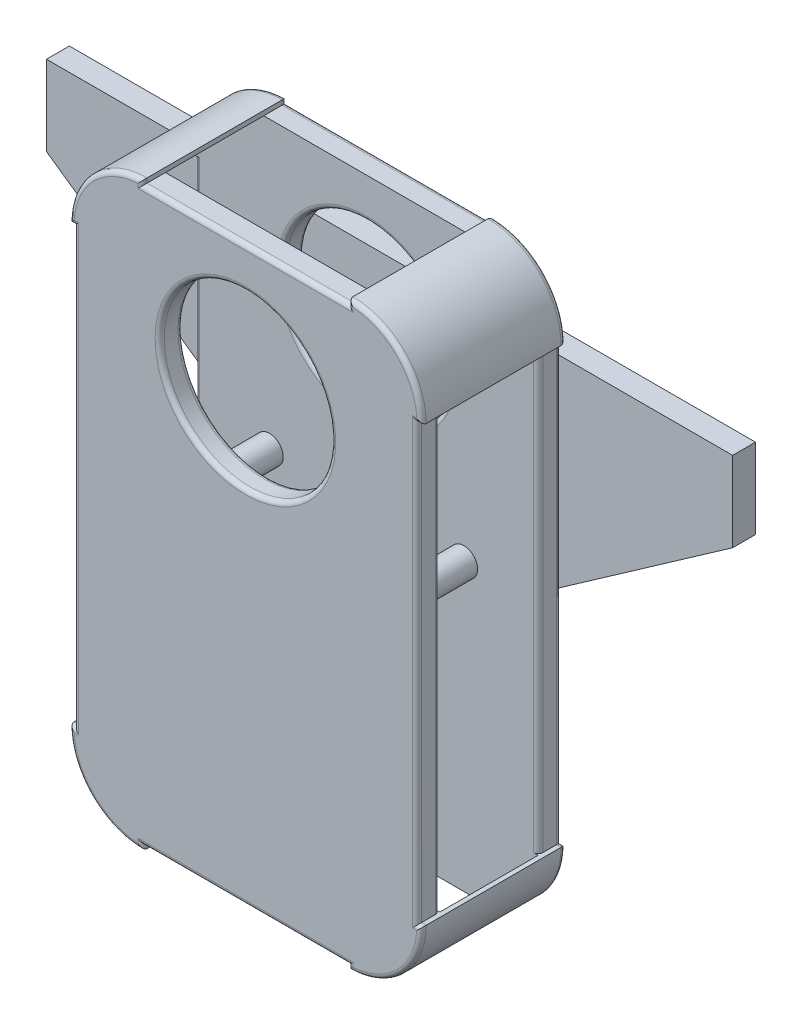
from build123d import *

# Parameters (mm, degrees)
BOSS_EXTRUDE1_DEPTH       = 10
BOSS_EXTRUDE2_DEPTH       = 10
SKETCH5_R                 = 37.5
CUT_EXTRUDE1_DEPTH        = 170
FILLET1_R                 = 2
FILLET2_R                 = 2
BOSS_EXTRUDE3_REACH       = 160.805
FILLET3_R                 = 2
FILLET4_R                 = 2
FILLET8_R                 = 2
SKETCH8_R                 = 6
CUT_EXTRUDE4_DEPTH        = 101
SKETCH19_R                = 6
BOSS_EXTRUDE11_DEPTH      = 63
BOSS_EXTRUDE11_2_DEPTH    = 63
BOSS_EXTRUDE12_DEPTH      = 43
BOSS_EXTRUDE12_DEPTH_BACK = 10
SKETCH20_R                = 6
BOSS_EXTRUDE13_START      = 63
BOSS_EXTRUDE13_DEPTH      = 10


# Some blends are built 0.0001 mm under size
with BuildPart() as part:
    # Sketch2 → Boss-Extrude1 (new body)
    with BuildSketch(Plane.XY):
        with BuildLine():
            Line((-45, -125), (45, -125))
            ThreePointArc((45, -125), (66.213203436, -116.213203436), (75, -95))
            Line((75, -95), (75, 95))
            ThreePointArc((75, 95), (66.213203436, 116.213203436), (45, 125))
            Line((45, 125), (-45, 125))
            ThreePointArc((-45, 125), (-66.213203436, 116.213203436), (-75, 95))
            Line((-75, 95), (-75, -95))
            ThreePointArc((-75, -95), (-66.213203436, -116.213203436), (-45, -125))
        make_face()
    extrude(amount=BOSS_EXTRUDE1_DEPTH)


with BuildPart() as body_2:
    # Sketch4 → Boss-Extrude2 (new body)
    with BuildSketch(Plane(origin=(0, 0, -43), x_dir=(-1, 0, 0), z_dir=(0, 0, -1))):
        with BuildLine():
            Line((75, -95), (75, 95))
            ThreePointArc((75, 95), (66.213203436, 116.213203436), (45, 125))
            Line((45, 125), (-45, 125))
            ThreePointArc((-45, 125), (-66.213203436, 116.213203436), (-75, 95))
            Line((-75, 95), (-75, -95))
            ThreePointArc((-75, -95), (-66.213203436, -116.213203436), (-45, -125))
            Line((-45, -125), (45, -125))
            ThreePointArc((45, -125), (66.213203436, -116.213203436), (75, -95))
        make_face()
    extrude(amount=BOSS_EXTRUDE2_DEPTH)


with BuildPart() as cut_extrude1_tool:
    # Sketch5 → Cut-Extrude1 (new body)
    with BuildSketch(Plane.XY.offset(10)):
        with Locations((0, 70)):
            Circle(SKETCH5_R)
    extrude(amount=-CUT_EXTRUDE1_DEPTH)


with BuildPart() as part_1:
    add(part.part)

    # Cut-Extrude1: cut by cut_extrude1_tool
    add(cut_extrude1_tool.part, mode=Mode.SUBTRACT)

    # Fillet1
    fillet1_edges = [part_1.edges().sort_by_distance(p)[0] for p in [
        (-37.5, 70, 0),
        (-37.5, 70, 10),
    ]]
    fillet(fillet1_edges, radius=FILLET1_R)

    # Boss-Extrude3: up to this face of the body (flat: up to its plane)
    boss_extrude3_end = Plane(part_1.part.faces().sort_by_distance((0, -10.781104943, 10))[0])
    # Sketch6 → Boss-Extrude3 (add, up to the picked face)
    with BuildSketch(Plane(origin=(0, 0, -53), x_dir=(-1, 0, 0), z_dir=(0, 0, -1)), mode=Mode.PRIVATE) as boss_extrude3_sk1:
        with BuildLine():
            Line((-45, 127), (-45, 125))
            ThreePointArc((-45, 125), (-66.213203436, 116.213203436), (-75, 95))
            Line((-75, 95), (-77, 95))
            ThreePointArc((-77, 95), (-67.627416998, 117.627416998), (-45, 127))
        make_face()
    boss_extrude3_tool1 = split(extrude(boss_extrude3_sk1.sketch, amount=-BOSS_EXTRUDE3_REACH, mode=Mode.PRIVATE), bisect_by=boss_extrude3_end, keep=Keep.BOTH, mode=Mode.PRIVATE)
    # Sketch6 → Boss-Extrude3 (add, up to the picked face)
    with BuildSketch(Plane(origin=(0, 0, -53), x_dir=(-1, 0, 0), z_dir=(0, 0, -1)), mode=Mode.PRIVATE) as boss_extrude3_sk2:
        with BuildLine():
            Line((45, 127), (45, 125))
            ThreePointArc((45, 125), (66.213203436, 116.213203436), (75, 95))
            Line((75, 95), (77, 95))
            ThreePointArc((77, 95), (67.627416998, 117.627416998), (45, 127))
        make_face()
    boss_extrude3_tool2 = split(extrude(boss_extrude3_sk2.sketch, amount=-BOSS_EXTRUDE3_REACH, mode=Mode.PRIVATE), bisect_by=boss_extrude3_end, keep=Keep.BOTH, mode=Mode.PRIVATE)
    # Sketch6 → Boss-Extrude3 (add, up to the picked face)
    with BuildSketch(Plane(origin=(0, 0, -53), x_dir=(-1, 0, 0), z_dir=(0, 0, -1)), mode=Mode.PRIVATE) as boss_extrude3_sk3:
        with BuildLine():
            Line((77, -95), (75, -95))
            ThreePointArc((75, -95), (66.213203436, -116.213203436), (45, -125))
            Line((45, -125), (45, -127))
            ThreePointArc((45, -127), (67.627416998, -117.627416998), (77, -95))
        make_face()
    boss_extrude3_tool3 = split(extrude(boss_extrude3_sk3.sketch, amount=-BOSS_EXTRUDE3_REACH, mode=Mode.PRIVATE), bisect_by=boss_extrude3_end, keep=Keep.BOTH, mode=Mode.PRIVATE)
    # Sketch6 → Boss-Extrude3 (add, up to the picked face)
    with BuildSketch(Plane(origin=(0, 0, -53), x_dir=(-1, 0, 0), z_dir=(0, 0, -1)), mode=Mode.PRIVATE) as boss_extrude3_sk4:
        with BuildLine():
            Line((-75, -95), (-77, -95))
            ThreePointArc((-77, -95), (-67.627416998, -117.627416998), (-45, -127))
            Line((-45, -127), (-45, -125))
            ThreePointArc((-45, -125), (-66.213203436, -116.213203436), (-75, -95))
        make_face()
    boss_extrude3_tool4 = split(extrude(boss_extrude3_sk4.sketch, amount=-BOSS_EXTRUDE3_REACH, mode=Mode.PRIVATE), bisect_by=boss_extrude3_end, keep=Keep.BOTH, mode=Mode.PRIVATE)


with BuildPart() as body_2_1:
    add(body_2.part)

    # Cut-Extrude1: cut by cut_extrude1_tool
    add(cut_extrude1_tool.part, mode=Mode.SUBTRACT)

    # Fillet2
    fillet2_edges = [body_2_1.edges().sort_by_distance(p)[0] for p in [
        (-37.5, 70, -53),
        (-37.5, 70, -43),
    ]]
    fillet(fillet2_edges, radius=FILLET2_R)


with BuildPart() as part_2:
    add(part_1.part)

    add(body_2_1.part)  # Boss-Extrude3 merges body 2
    add(boss_extrude3_tool1.solids().sort_by(Axis((67.307417, 117.307417, -53), (0, 0, 1)))[0])
    add(boss_extrude3_tool2.solids().sort_by(Axis((-67.307417, 117.307417, -53), (0, 0, 1)))[0])
    add(boss_extrude3_tool3.solids().sort_by(Axis((-76, -95.452548, -53), (0, 0, 1)))[0])
    add(boss_extrude3_tool4.solids().sort_by(Axis((76, -95.452548, -53), (0, 0, 1)))[0])

    # Fillet3
    fillet3_edges = [part_2.edges().sort_by_distance(p)[0] for p in [
        (75, 0, 10),
        (0, 125, 10),
        (-75, 0, 10),
        (-76, -95, 10),
        (-67.627416998, -117.627416998, 10),
        (-45, -126, 10),
        (45, -126, 10),
        (67.627416998, -117.627416998, 10),
        (76, -95, 10),
        (-45, 126, 10),
        (-67.627416998, 117.627416998, 10),
        (-76, 95, 10),
        (76, 95, 10),
        (67.627416998, 117.627416998, 10),
        (45, 126, 10),
        (0, -125, 10),
    ]]
    fillet(fillet3_edges, radius=FILLET3_R)

    # Fillet4
    fillet4_edges = [part_2.edges().sort_by_distance(p)[0] for p in [
        (-45, -126, -53),
        (-67.627416998, -117.627416998, -53),
        (-76, -95, -53),
        (-75, 0, -53),
        (0, 125, -53),
        (75, 0, -53),
        (0, -125, -53),
        (76, -95, -53),
        (67.627416998, -117.627416998, -53),
        (45, -126, -53),
        (-76, 95, -53),
        (-67.627416998, 117.627416998, -53),
        (-45, 126, -53),
        (45, 126, -53),
        (67.627416998, 117.627416998, -53),
        (76, 95, -53),
    ]]
    fillet(fillet4_edges, radius=FILLET4_R - 0.0001)  # a hair under: the kernel refuses the full size

    # Fillet8
    # the kernel refuses this fillet: 2 mm, written as the material it takes off along each edge
    with BuildSketch(Plane(origin=(75, -95, 0), x_dir=(-1, 0, 0), z_dir=(0, 1, 0)), Plane(origin=(75, 95, -43), x_dir=(-1, 0, 0), z_dir=(0, -1, 0))) as fillet8_piece_1:
        with BuildLine():
            CenterArc((FILLET8_R, FILLET8_R), FILLET8_R, 180, 90)
            Line((0, FILLET8_R), (0, 0))
            Line((0, 0), (FILLET8_R, 0))
        make_face()
    extrude(amount=190, mode=Mode.SUBTRACT)
    with BuildSketch(Plane(origin=(-75, -95, -43), x_dir=(0, 0, -1), z_dir=(0, 1, 0)), Plane(origin=(-75, 95, 0), x_dir=(0, 0, 1), z_dir=(0, -1, 0))) as fillet8_piece_2:
        with BuildLine():
            CenterArc((FILLET8_R, -FILLET8_R), FILLET8_R, 90, 90)
            Line((0, -FILLET8_R), (0, 0))
            Line((0, 0), (FILLET8_R, 0))
        make_face()
    extrude(amount=190, mode=Mode.SUBTRACT)

    # Sketch8 → Cut-Extrude4 (cut)
    with BuildSketch(Plane.XY.offset(10)):
        with Locations((42.5, 0)):
            Circle(SKETCH8_R)
        with Locations((-42.5, 0)):
            Circle(SKETCH8_R)
    extrude(amount=-CUT_EXTRUDE4_DEPTH, mode=Mode.SUBTRACT)

    # Sketch20 → Boss-Extrude12 (add, two sides: drawn at the far end of the back side and taken through both)
    with BuildSketch(Plane.XY.offset(-43).offset(-BOSS_EXTRUDE12_DEPTH_BACK)):
        with Locations(Location((0, -93.12, 0), (0, 0, 180))):
            Circle(SKETCH20_R)
    extrude(amount=BOSS_EXTRUDE12_DEPTH + BOSS_EXTRUDE12_DEPTH_BACK)



with BuildPart() as body_2_2:
    # Sketch19 → Boss-Extrude11 (new, through all)
    with BuildSketch(Plane.XY.offset(10)):
        with Locations((42.5, 0)):
            Circle(SKETCH19_R)
    extrude(amount=-BOSS_EXTRUDE11_DEPTH)


with BuildPart() as body_3:
    # Sketch19 → Boss-Extrude11 2 (new, through all)
    with BuildSketch(Plane.XY.offset(10)):
        with Locations((-42.5, 0)):
            Circle(SKETCH19_R)
    extrude(amount=-BOSS_EXTRUDE11_2_DEPTH)


with BuildPart() as part_3:
    add(part_2.part)

    add(body_2_2.part)  # Boss-Extrude13 merges body 2 2

    add(body_3.part)  # Boss-Extrude13 merges body 3
    # Sketch21 → Boss-Extrude13 (add)
    with BuildSketch(Plane(origin=(0, 0, 0), x_dir=(-1, 0, 0), z_dir=(0, 0, -1)).offset(BOSS_EXTRUDE13_START)):
        Polygon((150, 88.915980442), (150, 53.915980442), (73, 0), (-73, 0), (-150, 53.915980442), (-150, 88.915980442), align=None)
    extrude(amount=-BOSS_EXTRUDE13_DEPTH)


solid = part_3.part
